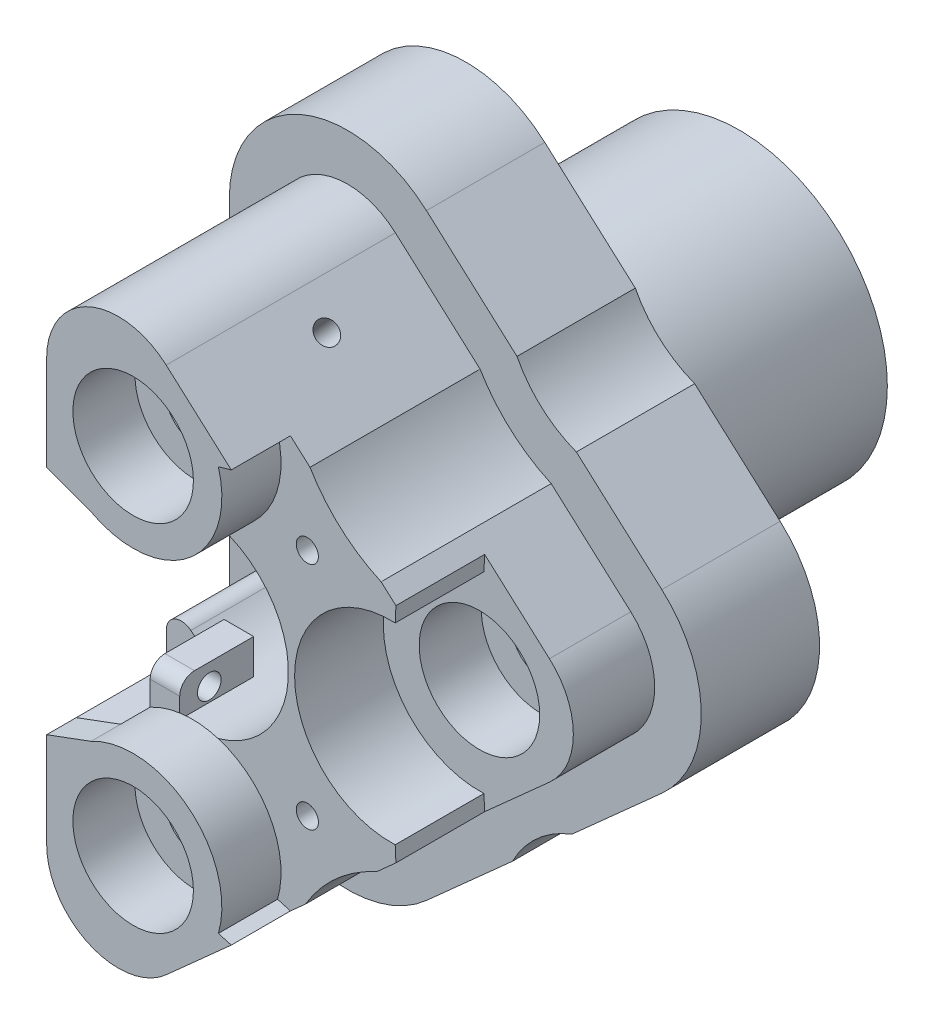
from build123d import *
from build123d.topology import SkipClean

# Parameters (mm, degrees)
BOSS_EXTRUDE1_DEPTH  = 15.5
BOSS_EXTRUDE3_START  = -2
SKETCH1_3_R          = 6.5
BOSS_EXTRUDE3_DEPTH  = 2
CUT_EXTRUDE11_START  = -4
CUT_EXTRUDE11_DEPTH  = 4
CUT_EXTRUDE13_START  = -10
CUT_EXTRUDE13_DEPTH  = 10
SKETCH15_R           = 2.500000000000001
CUT_EXTRUDE14_DEPTH  = 4.2
SKETCH16_R           = 2.5000000000000004
CUT_EXTRUDE15_DEPTH  = 4.2
SKETCH17_R           = 1.7499999999999998
CUT_EXTRUDE16_DEPTH  = 3
SKETCH18_R           = 1.4999999999999987
CUT_EXTRUDE17_DEPTH  = 3
SKETCH19_R           = 0.7500000000000004
CUT_EXTRUDE18_DEPTH  = 5
SKETCH20_R           = 0.7500000000000004
CUT_EXTRUDE19_DEPTH  = 5
SKETCH21_R           = 0.7500000000000004
CUT_EXTRUDE20_DEPTH  = 5
SKETCH22_R           = 0.7500000000000004
CUT_EXTRUDE21_DEPTH  = 5
BOSS_EXTRUDE4_START  = 15
SKETCH25_R           = 6.500000000000002
BOSS_EXTRUDE4_DEPTH  = 15
BOSS_EXTRUDE5_START  = -5
BOSS_EXTRUDE5_DEPTH  = 5
SKETCH29_R           = 4.074999999999996
SKETCH29_R_2         = 2.5000000000000013
SKETCH29_R_3         = 4.075
CUT_EXTRUDE27_DEPTH  = 4.2
SKETCH30_R           = 4.074999999999999
SKETCH30_R_2         = 2.5000000000000004
CUT_EXTRUDE28_DEPTH  = 4.2
SKETCH31_R           = 2
SKETCH31_R_2         = 1.7499999999999996
CUT_EXTRUDE30_DEPTH  = 3
SKETCH32_R           = 1.9999999999999996
CUT_EXTRUDE31_DEPTH  = 3
SKETCH33_R           = 0.7499999999999984
CUT_EXTRUDE32_DEPTH  = 8
SKETCH34_R           = 6.500000000000003
CUT_EXTRUDE33_DEPTH  = 6
CUT_EXTRUDE34_DEPTH  = 35.00000000000001
BOSS_EXTRUDE6_START  = 1
BOSS_EXTRUDE6_DEPTH  = 1
BOSS_EXTRUDE7_START  = 8.5
SKETCH39_R           = 6.500000000000002
BOSS_EXTRUDE7_DEPTH  = 8.5
SKETCH40_R           = 1.3
SKETCH40_R_2         = 1.2999999999999983
CUT_EXTRUDE36_DEPTH  = 8.5
BOSS_EXTRUDE8_START  = 5
BOSS_EXTRUDE8_DEPTH  = 5
BOSS_EXTRUDE9_DEPTH  = 3
CUT_EXTRUDE38_DEPTH  = 3
CUT_EXTRUDE39_START  = -8
CUT_EXTRUDE39_DEPTH  = 8
SKETCH45_W           = 8.100000000000005
SKETCH45_H           = 1.758590385799863
SKETCH45_H_2         = 1.7585903857998666
SKETCH45_H_3         = 1.9914096142001334
BOSS_EXTRUDE10_DEPTH = 2
SKETCH46_R           = 0.8000000000000009
CUT_EXTRUDE40_DEPTH  = 4
BOSS_EXTRUDE12_START = -4
BOSS_EXTRUDE12_DEPTH = 4
CUT_EXTRUDE42_START  = -4
CUT_EXTRUDE42_DEPTH  = 4
BOSS_EXTRUDE14_START = 0.9
BOSS_EXTRUDE14_DEPTH = 0.9
FILLET5_R            = 1
FILLET4_R            = 1
BOSS_EXTRUDE13_DEPTH = 2


with BuildPart() as part:
    # Sketch1 → Boss-Extrude1 (new body)
    with BuildSketch(Plane.XY):
        with BuildLine():
            ThreePointArc((2.333333333333339, 17.962847939999442), (-3.0412414523193125, 18.80042262337618), (-6, 14.236067977499792))
            Line((-6, 14.236067977499793), (-5.999999999999999, 2.5000000000002522))
            ThreePointArc((-5.999999999999902, 2.500000000000234), (1.2747548783983207, 6.373774391990956), (6.5, 0))
            ThreePointArc((6.5, -1.59e-15), (1.2747548783983234, -6.373774391990955), (-5.9999999999999005, -2.500000000000238))
            Line((-5.999999999999998, -2.500000000000256), (-5.999999999999997, -14.236067977499793))
            ThreePointArc((-5.9999999999999964, -14.236067977499792), (-3.041241452319313, -18.800422623376175), (2.333333333333333, -17.96284793999944))
            Line((2.333333333333334, -17.96284793999944), (7.773705012480982, -13.096831581023915))
            ThreePointArc((7.773705012480981, -13.096831581023913), (9.826675189693717, -10.589778838962985), (12.546312033573123, -8.828082089401992))
            Line((12.546312033573123, -8.828082089401994), (18.249741198332075, -3.726779962499654))
            ThreePointArc((18.249741198332075, -3.726779962499654), (19.91640786499874, -4.11e-15), (18.249741198332075, 3.726779962499646))
            Line((18.249741198332075, 3.7267799624996445), (12.848616270294984, 8.557692960123482))
            ThreePointArc((12.848616270294983, 8.55769296012348), (10.128979426415608, 10.319389709684462), (8.076009249202896, 12.826442451745363))
            Line((8.076009249202896, 12.826442451745363), (2.3333333333333384, 17.962847939999442))
        make_face()
    extrude(amount=BOSS_EXTRUDE1_DEPTH)

    # Sketch1<3> → Boss-Extrude3 (add)
    with BuildSketch(Plane.XY.offset(BOSS_EXTRUDE3_START)):
        with BuildLine():
            Line((-9.000000000000002, 14.236067977499793), (-8.999999999999998, -14.236067977499792))
            ThreePointArc((-8.999999999999998, -14.236067977499792), (-4.265986323710903, -21.539035410902006), (4.333333333333334, -20.19891591749923))
            Line((4.333333333333334, -20.19891591749923), (10.153076093228329, -14.993579748424253))
            ThreePointArc((10.153076093228329, -14.993579748424253), (11.826675189693717, -12.825846816462779), (14.166940952825776, -11.403469877001235))
            Line((14.166940952825776, -11.403469877001235), (20.249741198332075, -5.962847939999441))
            ThreePointArc((20.249741198332075, -5.962847939999441), (22.91640786499874, -5.2e-15), (20.249741198332075, 5.962847939999432))
            Line((20.249741198332075, 5.962847939999432), (14.469245189547644, 11.133080747722715))
            ThreePointArc((14.469245189547644, 11.133080747722715), (12.128979426415611, 12.555457687184248), (10.455380329950238, 14.723190619145699))
            Line((10.455380329950238, 14.723190619145699), (4.333333333333336, 20.19891591749924))
            ThreePointArc((4.333333333333336, 20.19891591749924), (-4.265986323710905, 21.539035410902013), (-9.000000000000002, 14.236067977499793))
        make_face()
        with Locations(Location((0, 0, 0), (0, 0, 202.619864948))):
            Circle(SKETCH1_3_R, mode=Mode.SUBTRACT)
    extrude(amount=BOSS_EXTRUDE3_DEPTH)

    # Sketch14 → Cut-Extrude11 (cut)
    with BuildSketch(Plane.XY.offset(15.5).offset(CUT_EXTRUDE11_START)):
        with BuildLine():
            Line((6.805469288332918, 13.962847939999444), (5.7650020462537634, 13.662754163034908))
            ThreePointArc((5.765002046253755, 13.66275416303494), (5.273685061680846, 9.13848888343863), (1.7484802428744484, 6.260416666666672))
            ThreePointArc((1.748480242874447, 6.260416666666668), (6.500000000000002, -1.0991e-13), (1.748480242874225, -6.260416666666719))
            ThreePointArc((1.748480242874229, -6.260416666666605), (5.273685061680793, -9.138488883438532), (5.765002046253753, -13.662754163034947))
            Line((5.7650020462537634, -13.662754163034915), (6.8054692883329135, -13.962847939999449))
            Line((6.805469288332911, -13.962847939999445), (7.77370501248098, -13.096831581023919))
            ThreePointArc((7.7737050124809794, -13.096831581023919), (9.826675189693713, -10.589778838962985), (12.546312033573123, -8.828082089401992))
            Line((12.546312033573123, -8.828082089401992), (18.249741198332075, -3.726779962499654))
            ThreePointArc((18.249741198332075, -3.7267799624996543), (19.91640786499874, -5.22e-15), (18.249741198332075, 3.726779962499643))
            Line((18.249741198332075, 3.726779962499643), (12.848616270294986, 8.557692960123482))
            ThreePointArc((12.848616270294986, 8.557692960123482), (10.128979426415611, 10.31938970968446), (8.076009249202896, 12.826442451745361))
            Line((8.076009249202896, 12.826442451745361), (6.805469288332915, 13.962847939999442))
        make_face()
    extrude(amount=CUT_EXTRUDE11_DEPTH, mode=Mode.SUBTRACT)

    # Sketch14<4> → Cut-Extrude13 (cut)
    with BuildSketch(Plane.XY.offset(15.5).offset(CUT_EXTRUDE13_START)):
        with BuildLine():
            Line((18.249741198332075, 3.7267799624996436), (13.777605243332493, 7.726779962499647))
            Line((13.777605243332493, 7.726779962499646), (13.684905148289488, 5.743727814657093))
            ThreePointArc((13.68490514828951, 5.743727814657091), (7.666407864998731, 5.81e-15), (13.6849051482895, -5.743727814657092))
            Line((13.684905148289488, -5.743727814657093), (13.777605243332491, -7.726779962499654))
            Line((13.777605243332491, -7.726779962499652), (18.249741198332075, -3.726779962499654))
            ThreePointArc((18.249741198332075, -3.7267799624996543), (19.91640786499874, -5.22e-15), (18.249741198332075, 3.726779962499643))
        make_face()
    extrude(amount=CUT_EXTRUDE13_DEPTH, mode=Mode.SUBTRACT)

    # Sketch15 → Cut-Extrude14 (cut)
    with BuildSketch(Plane.XY.offset(15.5)):
        with Locations((0, 12)):
            Circle(SKETCH15_R)
        with Locations((0, -12)):
            Circle(SKETCH15_R)
    extrude(amount=-CUT_EXTRUDE14_DEPTH, mode=Mode.SUBTRACT)

    # Sketch16 → Cut-Extrude15 (cut)
    with BuildSketch(Plane.XY.offset(5.5)):
        with Locations((13.416407864998735, 0)):
            Circle(SKETCH16_R)
    extrude(amount=-CUT_EXTRUDE15_DEPTH, mode=Mode.SUBTRACT)

    # Sketch17 → Cut-Extrude16 (cut)
    with BuildSketch(Plane.XY.offset(11.299999999999999)):
        with Locations((0, -12)):
            Circle(SKETCH17_R)
        with Locations((0, 12)):
            Circle(SKETCH17_R)
    extrude(amount=-CUT_EXTRUDE16_DEPTH, mode=Mode.SUBTRACT)

    # Sketch18 → Cut-Extrude17 (cut)
    with BuildSketch(Plane.XY.offset(1.2999999999999992)):
        with Locations((13.416407864998735, 0)):
            Circle(SKETCH18_R)
    extrude(amount=-CUT_EXTRUDE17_DEPTH, mode=Mode.SUBTRACT)

    # Sketch19 → Cut-Extrude18 (cut)
    with BuildSketch(Plane(origin=(9.962847939999445, -11.138802621666256, 0), x_dir=(0.74535599249993, 0.6666666666666667, 0), z_dir=(0.6666666666666667, -0.74535599249993, 0))):
        with Locations((-7.736067977499796, 6.500000000000001)):
            Circle(SKETCH19_R)
    extrude(amount=-CUT_EXTRUDE18_DEPTH, mode=Mode.SUBTRACT)

    # Sketch20 → Cut-Extrude19 (cut)
    with BuildSketch(Plane.ZY.offset(5.999999999999998)):
        with Locations(Location((6.500000000000001, -11.73606797749979, 0), (0, 0, 270))):
            Circle(SKETCH20_R)
    extrude(amount=-CUT_EXTRUDE19_DEPTH, mode=Mode.SUBTRACT)

    # Sketch21 → Cut-Extrude20 (cut)
    with BuildSketch(Plane.ZY.offset(5.999999999999998)):
        with Locations(Location((6.500000000000001, 11.736067977499792, 0), (0, 0, 270))):
            Circle(SKETCH21_R)
    extrude(amount=-CUT_EXTRUDE20_DEPTH, mode=Mode.SUBTRACT)

    # Sketch22 → Cut-Extrude21 (cut)
    with BuildSketch(Plane(origin=(9.962847939999449, 11.138802621666251, 0), x_dir=(0.7453559924999298, -0.6666666666666669, 0), z_dir=(0.6666666666666669, 0.7453559924999298, 0))):
        with Locations(Location((-7.736067977499794, -6.500000000000001, 0), (0, 0, 180))):
            Circle(SKETCH22_R)
    extrude(amount=-CUT_EXTRUDE21_DEPTH, mode=Mode.SUBTRACT)

    # Sketch25 → Boss-Extrude4 (add)
    with SkipClean():  # the faces are left unmerged after this step: merging them gives an invalid solid
        with BuildSketch(Plane(origin=(0, 0, -2), x_dir=(-1, 0, 0), z_dir=(0, 0, -1)).offset(BOSS_EXTRUDE4_START)):
            with BuildLine():
                Line((9, -4.358898943540911), (9, 4.358898943540908))
                ThreePointArc((8.999999999999897, 4.358898943540885), (-10, 1.22e-15), (8.999999999999897, -4.358898943540887))
            make_face()
            Circle(SKETCH25_R, mode=Mode.SUBTRACT)
        extrude(amount=-BOSS_EXTRUDE4_DEPTH)

    # Sketch27 → Boss-Extrude5 (add)
    with SkipClean():  # the faces are left unmerged after this step: merging them gives an invalid solid
        with BuildSketch(Plane.XY.offset(11.5).offset(BOSS_EXTRUDE5_START)):
            with BuildLine():
                ThreePointArc((1.1287131548350784, 6.401250394579349), (-1.1287131548350324, 6.401250394579357), (-3.2500000000000018, 5.6291651245988525))
                Line((-3.2499999999999685, 5.62916512459887), (-2.7499999999999725, 4.7631397208144275))
                ThreePointArc((-2.7500000000001203, 4.763139720814343), (-0.9550649771682416, 5.416442641567122), (0.9550649771680044, 5.416442641567164))
                Line((0.9550649771680784, 5.41644264156715), (1.1287131548350022, 6.401250394579362))
            make_face()
            with BuildLine():
                Line((1.1287131548350537, -6.401250394579352), (0.955064977168122, -5.416442641567142))
                ThreePointArc((0.9550649771680463, -5.416442641567157), (-0.9550649771682398, -5.416442641567123), (-2.750000000000154, -4.7631397208143245))
                Line((-2.750000000000005, -4.76313972081441), (-3.2500000000000067, -5.62916512459885))
                ThreePointArc((-3.2500000000000377, -5.629165124598831), (-1.1287131548350267, -6.401250394579357), (1.1287131548351317, -6.40125039457934))
            make_face()
        extrude(amount=BOSS_EXTRUDE5_DEPTH)

    # Sketch29 → Cut-Extrude27 (cut)
    # profile 1 of 2: a face of its own
    with SkipClean():  # the faces are left unmerged after this step: merging them gives an invalid solid
        with BuildSketch(Plane.XY.offset(15.5)):
            with Locations((0, 12)):
                Circle(SKETCH29_R)
            with Locations((0, 12)):
                Circle(SKETCH29_R_2, mode=Mode.SUBTRACT)
        # profile 2 of 2: a face of its own
        with BuildSketch(Plane.XY.offset(15.5)):
            with Locations((0, -12)):
                Circle(SKETCH29_R_3)
            with Locations((0, -12)):
                Circle(SKETCH29_R_2, mode=Mode.SUBTRACT)
        extrude(amount=-CUT_EXTRUDE27_DEPTH, mode=Mode.SUBTRACT)

    # Sketch30 → Cut-Extrude28 (cut)
    with SkipClean():  # the faces are left unmerged after this step: merging them gives an invalid solid
        with BuildSketch(Plane.XY.offset(5.5)):
            with Locations((13.416407864998735, 0)):
                Circle(SKETCH30_R)
            with Locations((13.416407864998735, 0)):
                Circle(SKETCH30_R_2, mode=Mode.SUBTRACT)
        extrude(amount=-CUT_EXTRUDE28_DEPTH, mode=Mode.SUBTRACT)

    # Sketch31 → Cut-Extrude30 (cut)
    # profile 1 of 2: a face of its own
    with SkipClean():  # the faces are left unmerged after this step: merging them gives an invalid solid
        with BuildSketch(Plane.XY.offset(11.299999999999999)):
            with Locations((0, 12)):
                Circle(SKETCH31_R)
            with Locations((0, 12)):
                Circle(SKETCH31_R_2, mode=Mode.SUBTRACT)
        # profile 2 of 2: a face of its own
        with BuildSketch(Plane.XY.offset(11.299999999999999)):
            with Locations((0, -12)):
                Circle(SKETCH31_R)
            with Locations((0, -12)):
                Circle(SKETCH31_R_2, mode=Mode.SUBTRACT)
        extrude(amount=-CUT_EXTRUDE30_DEPTH, mode=Mode.SUBTRACT)

    # Sketch32 → Cut-Extrude31 (cut)
    with SkipClean():  # the faces are left unmerged after this step: merging them gives an invalid solid
        with BuildSketch(Plane.XY.offset(1.2999999999999992)):
            with Locations((13.416407864998735, 0)):
                Circle(SKETCH32_R)
        extrude(amount=-CUT_EXTRUDE31_DEPTH, mode=Mode.SUBTRACT)

    # Sketch33 → Cut-Extrude32 (cut)
    with SkipClean():  # the faces are left unmerged after this step: merging them gives an invalid solid
        with BuildSketch(Plane.XY.offset(11.5)):
            with Locations((7.778174593052007, 7.778174593052036)):
                Circle(SKETCH33_R)
            with Locations((7.778174593052009, -7.778174593052034)):
                Circle(SKETCH33_R)
        extrude(amount=-CUT_EXTRUDE32_DEPTH, mode=Mode.SUBTRACT)

    # Sketch34 → Cut-Extrude33 (cut)
    with SkipClean():  # the faces are left unmerged after this step: merging them gives an invalid solid
        with BuildSketch(Plane.XY.offset(11.5)):
            with Locations((13.416407864998735, 0)):
                Circle(SKETCH34_R)
        extrude(amount=-CUT_EXTRUDE33_DEPTH, mode=Mode.SUBTRACT)

    # Sketch35 → Cut-Extrude34 (cut)
    with SkipClean():  # the faces are left unmerged after this step: merging them gives an invalid solid
        with BuildSketch(Plane.XY):
            with BuildLine():
                Line((-5.999999999999998, 2.5000000000000058), (-6, 14.236067977499793))
                ThreePointArc((-6, 14.236067977499793), (-3.0412414523193125, 18.80042262337618), (2.3333333333333375, 17.962847939999442))
                Line((2.3333333333333375, 17.962847939999442), (8.076009249202896, 12.826442451745361))
                ThreePointArc((8.076009249202896, 12.826442451745361), (10.128979426415611, 10.31938970968446), (12.848616270294984, 8.557692960123482))
                Line((12.848616270294984, 8.557692960123482), (18.249741198332075, 3.7267799624996436))
                ThreePointArc((18.249741198332075, 3.7267799624996436), (19.91640786499874, -4.09e-15), (18.249741198332075, -3.7267799624996507))
                Line((18.249741198332075, -3.7267799624996507), (12.546312033573123, -8.828082089401992))
                ThreePointArc((12.546312033573123, -8.828082089401992), (9.826675189693713, -10.589778838962985), (7.773705012480982, -13.09683158102392))
                Line((7.773705012480982, -13.09683158102392), (2.333333333333332, -17.962847939999445))
                ThreePointArc((2.333333333333332, -17.962847939999445), (-3.0412414523193156, -18.80042262337618), (-5.999999999999997, -14.236067977499792))
                Line((-5.999999999999997, -14.236067977499792), (-5.999999999999998, -2.5000000000000067))
                ThreePointArc((-5.999999999999998, -2.5000000000000067), (-6.500000000000001, -8e-16), (-5.999999999999998, 2.5000000000000058))
            make_face()
            with BuildLine():
                Line((7.958611909439632, 12.730199706605697), (2.233333333333337, 17.851044541124455))
                ThreePointArc((2.233333333333337, 17.851044541124455), (-2.980004208749736, 18.66349198399989), (-5.850000000000001, 14.236067977499793))
                Line((-5.850000000000001, 14.236067977499793), (-5.8500000000000005, 2.469817807045695))
                ThreePointArc((-5.8500000000000005, 2.469817807045695), (-6.350000000000001, -2.04e-15), (-5.849999999999999, -2.469817807045699))
                Line((-5.849999999999999, -2.469817807045699), (-5.849999999999998, -14.236067977499792))
                ThreePointArc((-5.849999999999998, -14.236067977499792), (-2.9800042087497385, -18.663491983999883), (2.2333333333333294, -17.85104454112446))
                Line((2.2333333333333294, -17.85104454112446), (7.656307672717711, -13.000588835884262))
                ThreePointArc((7.656307672717711, -13.000588835884262), (9.726675189693715, -10.477975440087999), (12.463709373336389, -8.700718036791674))
                Line((12.463709373336389, -8.700718036791674), (18.149741198332073, -3.6149765636246602))
                ThreePointArc((18.149741198332073, -3.6149765636246602), (19.766407864998737, -4.13e-15), (18.149741198332073, 3.6149765636246527))
                Line((18.149741198332073, 3.6149765636246527), (12.766013610058263, 8.430328907513159))
                ThreePointArc((12.766013610058263, 8.430328907513159), (10.028979426415619, 10.207586310809466), (7.958611909439632, 12.730199706605697))
            make_face(mode=Mode.SUBTRACT)
        extrude(amount=CUT_EXTRUDE34_DEPTH, mode=Mode.SUBTRACT)

    # Sketch37 → Boss-Extrude6 (add)
    with SkipClean():  # the faces are left unmerged after this step: merging them gives an invalid solid
        with BuildSketch(Plane(origin=(0, 0, -2), x_dir=(-1, 0, 0), z_dir=(0, 0, -1)).offset(BOSS_EXTRUDE6_START)):
            with BuildLine():
                Line((9, 4.358898943540674), (9.000000000000002, 14.236067977499793))
                ThreePointArc((9.000000000000002, 14.236067977499793), (4.265986323710905, 21.53903541090201), (-4.333333333333336, 20.198915917499235))
                Line((-4.333333333333336, 20.198915917499235), (-10.455380329950238, 14.723190619145699))
                ThreePointArc((-10.455380329950238, 14.723190619145699), (-12.128979426415611, 12.555457687184248), (-14.469245189547644, 11.133080747722715))
                Line((-14.469245189547644, 11.133080747722715), (-20.249741198332075, 5.962847939999429))
                ThreePointArc((-20.249741198332075, 5.962847939999429), (-22.91640786499874, -6.7e-16), (-20.249741198332075, -5.962847939999437))
                Line((-20.249741198332075, -5.962847939999437), (-14.166940952825776, -11.403469877001235))
                ThreePointArc((-14.166940952825776, -11.403469877001235), (-11.826675189693717, -12.82584681646278), (-10.153076093228329, -14.993579748424258))
                Line((-10.153076093228329, -14.993579748424258), (-4.333333333333335, -20.19891591749923))
                ThreePointArc((-4.333333333333335, -20.19891591749923), (4.265986323710904, -21.539035410902006), (8.999999999999998, -14.236067977499792))
                Line((8.999999999999998, -14.236067977499792), (8.999999999999998, -4.358898943540678))
                ThreePointArc((8.999999999999998, -4.358898943540678), (-10, 5.67e-15), (9, 4.358898943540674))
            make_face()
        extrude(amount=-BOSS_EXTRUDE6_DEPTH)

    # Sketch39 → Boss-Extrude7 (add)
    with SkipClean():  # the faces are left unmerged after this step: merging them gives an invalid solid
        with BuildSketch(Plane(origin=(0, 0, -17), x_dir=(-1, 0, 0), z_dir=(0, 0, -1)).offset(BOSS_EXTRUDE7_START)):
            with BuildLine():
                Line((9, -4.358898943540676), (9, 4.358898943540674))
                ThreePointArc((9, 4.358898943540674), (-10, 5.67e-15), (9, -4.358898943540676))
            make_face()
            Circle(SKETCH39_R, mode=Mode.SUBTRACT)
        extrude(amount=-BOSS_EXTRUDE7_DEPTH)

    # Sketch40 → Cut-Extrude36 (cut)
    with SkipClean():  # the faces are left unmerged after this step: merging them gives an invalid solid
        with BuildSketch(Plane.ZY.offset(9)):
            with Locations(Location((-5.500000000000002, 0, 0), (0, 0, 270))):
                Circle(SKETCH40_R)
            with Locations(Location((-17.5, 0, 0), (0, 0, 270))):
                Circle(SKETCH40_R_2)
        extrude(amount=-CUT_EXTRUDE36_DEPTH, mode=Mode.SUBTRACT)

    # Sketch41 → Boss-Extrude8 (add)
    with SkipClean():  # the faces are left unmerged after this step: merging them gives an invalid solid
        with BuildSketch(Plane(origin=(0, 0, -3), x_dir=(-1, 0, 0), z_dir=(0, 0, -1)).offset(BOSS_EXTRUDE8_START)):
            with BuildLine():
                Line((9, 4.358898943540674), (9.000000000000002, 14.236067977499793))
                ThreePointArc((9.000000000000002, 14.236067977499793), (4.265986323710905, 21.53903541090201), (-4.333333333333336, 20.198915917499235))
                Line((-4.333333333333336, 20.198915917499235), (-10.455380329950238, 14.723190619145699))
                ThreePointArc((-10.455380329950238, 14.723190619145699), (-12.128979426415611, 12.555457687184248), (-14.469245189547644, 11.133080747722715))
                Line((-14.469245189547644, 11.133080747722715), (-20.249741198332075, 5.962847939999429))
                ThreePointArc((-20.249741198332075, 5.962847939999429), (-22.91640786499874, -6.7e-16), (-20.249741198332075, -5.962847939999437))
                Line((-20.249741198332075, -5.962847939999437), (-14.166940952825776, -11.403469877001239))
                ThreePointArc((-14.166940952825776, -11.403469877001239), (-11.826675189693717, -12.82584681646278), (-10.153076093228329, -14.993579748424258))
                Line((-10.153076093228329, -14.993579748424258), (-4.333333333333339, -20.198915917499225))
                ThreePointArc((-4.333333333333339, -20.198915917499225), (4.265986323710898, -21.539035410902006), (8.999999999999998, -14.236067977499792))
                Line((8.999999999999998, -14.236067977499792), (8.999999999999998, -4.358898943540678))
                ThreePointArc((8.999999999999998, -4.358898943540678), (-10, 5.67e-15), (9, 4.358898943540674))
            make_face()
        extrude(amount=-BOSS_EXTRUDE8_DEPTH)

    # Sketch43 → Boss-Extrude9 (add)
    with SkipClean():  # the faces are left unmerged after this step: merging them gives an invalid solid
        with BuildSketch(Plane(origin=(0, 0, 6.5), x_dir=(-1, 0, 0), z_dir=(0, 0, -1))):
            with BuildLine():
                Line((-0.9550649771680783, 5.416442641567152), (-0.6945927106676931, 3.9392310120488374))
                ThreePointArc((-0.6945927106678551, 3.9392310120488085), (0.6945927106676211, 3.93923101204885), (1.9999999999999405, 3.464101615137789))
                Line((1.9999999999999807, 3.464101615137766), (2.7499999999999734, 4.763139720814428))
                ThreePointArc((2.7499999999999734, 4.763139720814428), (0.9550649771681203, 5.416442641567143), (-0.955064977168079, 5.416442641567153))
            make_face()
            with BuildLine():
                ThreePointArc((1.9999999999999634, -3.4641016151377757), (0.6945927106676149, -3.939231012048851), (-0.6945927106678893, -3.9392310120488028))
                Line((-0.6945927106677282, -3.9392310120488303), (-0.9550649771681264, -5.4164426415671425))
                ThreePointArc((-0.9550649771681263, -5.416442641567142), (0.9550649771681146, -5.416442641567143), (2.7500000000000044, -4.76313972081441))
                Line((2.7500000000000044, -4.76313972081441), (2.000000000000003, -3.4641016151377526))
            make_face()
        extrude(amount=-BOSS_EXTRUDE9_DEPTH)

    # Sketch42 → Cut-Extrude38 (cut)
    with SkipClean():  # the faces are left unmerged after this step: merging them gives an invalid solid
        with BuildSketch(Plane.ZY.offset(5.8500000000000005)):
            Polygon((7.399999999999999, -2.8332843133014416), (7.3999999999999995, -7.833284313301447), (15.5, -7.833284313301445), (15.5, -2.8332843133014416), align=None)
            Polygon((7.399999999999998, 7.83328431330144), (7.399999999999999, 2.83328431330144), (15.5, 2.83328431330144), (15.5, 7.833284313301442), align=None)
        extrude(amount=-CUT_EXTRUDE38_DEPTH, mode=Mode.SUBTRACT)

    # Sketch44 → Cut-Extrude39 (cut)
    with SkipClean():  # the faces are left unmerged after this step: merging them gives an invalid solid
        with BuildSketch(Plane.XY.offset(11.5).offset(CUT_EXTRUDE39_START)):
            with BuildLine():
                ThreePointArc((0.9550649771681221, -5.4164426415671425), (-0.9550649771681178, -5.416442641567143), (-2.7500000000000044, -4.76313972081441))
                Line((-2.7500000000000044, -4.76313972081441), (-2.8499999999999996, -4.9363448015712885))
                Line((-2.8499999999999996, -4.9363448015712885), (-2.8499999999999996, -5.841874699101308))
                ThreePointArc((-2.8499999999999996, -5.841874699101308), (-0.9049488344693095, -6.4366969485126955), (1.1287131548350535, -6.4012503945793515))
                Line((1.1287131548350535, -6.4012503945793515), (0.9550649771681221, -5.4164426415671425))
            make_face()
            with BuildLine():
                ThreePointArc((-2.0000000000000036, -3.4641016151377526), (-0.6945927106677203, -3.9392310120488325), (0.6945927106677285, -3.939231012048832))
                Line((0.6945927106677285, -3.939231012048832), (0.9550649771681221, -5.4164426415671425))
                ThreePointArc((0.9550649771681221, -5.4164426415671425), (-0.9550649771681178, -5.416442641567143), (-2.7500000000000044, -4.76313972081441))
                Line((-2.7500000000000044, -4.76313972081441), (-2.0000000000000036, -3.4641016151377526))
            make_face()
            with BuildLine():
                ThreePointArc((0.6945927106676931, 3.9392310120488374), (-0.6945927106677248, 3.9392310120488316), (-1.9999999999999805, 3.4641016151377655))
                Line((-1.9999999999999805, 3.4641016151377655), (-2.7499999999999734, 4.763139720814428))
                ThreePointArc((-2.7499999999999734, 4.763139720814428), (-0.9550649771681203, 5.416442641567143), (0.9550649771680781, 5.416442641567152))
                Line((0.9550649771680781, 5.416442641567152), (0.6945927106676931, 3.9392310120488374))
            make_face()
            with BuildLine():
                ThreePointArc((0.9550649771680786, 5.416442641567151), (-0.9550649771681203, 5.416442641567143), (-2.7499999999999734, 4.763139720814428))
                Line((-2.7499999999999734, 4.763139720814428), (-2.8500000000000005, 4.936344801571365))
                Line((-2.8500000000000005, 4.936344801571365), (-2.8500000000000005, 5.841874699101308))
                ThreePointArc((-2.8500000000000005, 5.841874699101308), (-0.9049488344693355, 6.436696948512693), (1.1287131548350022, 6.401250394579361))
                Line((1.1287131548350022, 6.401250394579361), (0.9550649771680786, 5.416442641567151))
            make_face()
            with BuildLine():
                Line((-2.8499999999999996, -4.9363448015712885), (-2.7500000000000044, -4.76313972081441))
                Line((-2.7500000000000044, -4.76313972081441), (-2.0000000000000036, -3.4641016151377526))
                ThreePointArc((-2.000000000000004, -3.4641016151377526), (-0.69459271066772, -3.9392310120488334), (0.6945927106677289, -3.9392310120488325))
                Line((0.6945927106677285, -3.939231012048832), (0.9550649771681221, -5.4164426415671425))
                Line((0.9550649771681221, -5.4164426415671425), (1.1287131548350506, -6.401250394579352))
                ThreePointArc((1.1287131548350506, -6.401250394579354), (4.979288880273361, -4.1781194629625045), (6.500000000000002, -1.59e-15))
                ThreePointArc((6.500000000000002, 0), (4.979288880273344, 4.178119462962524), (1.1287131548350025, 6.401250394579362))
                Line((1.1287131548350022, 6.401250394579361), (0.9550649771680786, 5.416442641567151))
                Line((0.9550649771680781, 5.416442641567152), (0.6945927106676931, 3.9392310120488374))
                ThreePointArc((0.6945927106676931, 3.9392310120488374), (-0.6945927106677247, 3.9392310120488316), (-1.9999999999999805, 3.4641016151377655))
                Line((-1.9999999999999805, 3.4641016151377655), (-2.749999999999974, 4.7631397208144275))
                Line((-2.7499999999999734, 4.763139720814428), (-2.8500000000000005, 4.936344801571365))
                Line((-2.8500000000000005, 4.936344801571365), (-2.8500000000000005, 5.841874699101308))
                ThreePointArc((-2.8500000000000014, 5.841874699101309), (-6.500000000000002, 8e-16), (-2.8500000000000028, -5.841874699101309))
                Line((-2.8499999999999996, -5.841874699101308), (-2.8499999999999996, -4.9363448015712885))
            make_face()
        extrude(amount=CUT_EXTRUDE39_DEPTH, mode=Mode.SUBTRACT)

    # Sketch45 → Boss-Extrude10 (add)
    with SkipClean():  # the faces are left unmerged after this step: merging them gives an invalid solid
        with BuildSketch(Plane.ZY.offset(2.85)):
            Polygon((15.5, -7.833284313301445), (15.5, -5.841874699101308), (7.3999999999999995, -5.841874699101308), (7.399999999999999, -7.833284313301445), align=None)
            with Locations((11.45, -4.962579506201377)):
                Rectangle(SKETCH45_W, SKETCH45_H)
            with Locations((11.45, 4.962579506201375)):
                Rectangle(SKETCH45_W, SKETCH45_H_2)
            with Locations((11.45, 6.837579506201375)):
                Rectangle(SKETCH45_W, SKETCH45_H_3)
        extrude(amount=-BOSS_EXTRUDE10_DEPTH)

    # Sketch46 → Cut-Extrude40 (cut)
    with SkipClean():  # the faces are left unmerged after this step: merging them gives an invalid solid
        with BuildSketch(Plane.ZY.offset(2.85)):
            with Locations(Location((9.499999999999998, -5.503284313301444, 0), (0, 0, 270))):
                Circle(SKETCH46_R)
            with Locations(Location((9.499999999999998, 5.503284313301441, 0), (0, 0, 270))):
                Circle(SKETCH46_R)
        extrude(amount=-CUT_EXTRUDE40_DEPTH, mode=Mode.SUBTRACT)

    # Sketch47 → Boss-Extrude12 (add)
    with SkipClean():  # the faces are left unmerged after this step: merging them gives an invalid solid
        with BuildSketch(Plane.XY.offset(15.5).offset(BOSS_EXTRUDE12_START)):
            with BuildLine():
                ThreePointArc((1.7484802428744324, -6.260416666666668), (0.46022495227701343, -6.01767662247337), (-0.8500000000002212, -6.060513490208129))
                Line((-0.8500000000000018, -6.060513490208159), (-0.8500000000000022, -6.4441834238326905))
                ThreePointArc((-0.8500000000000023, -6.4441834238326905), (0.4585403384313669, -6.483806039513462), (1.748480242874432, -6.260416666666668))
            make_face()
            with BuildLine():
                Line((-0.8500000000000006, 6.44418342383269), (-0.8500000000000006, 6.060513490208159))
                ThreePointArc((-0.8500000000002215, 6.060513490208129), (0.460224952277012, 6.01767662247337), (1.7484802428744306, 6.260416666666668))
                ThreePointArc((1.7484802428744315, 6.260416666666666), (0.4585403384313673, 6.483806039513462), (-0.8500000000000005, 6.444183423832689))
            make_face()
        extrude(amount=BOSS_EXTRUDE12_DEPTH)

    # Sketch47<6> → Cut-Extrude42 (cut)
    with SkipClean():  # the faces are left unmerged after this step: merging them gives an invalid solid
        with BuildSketch(Plane.XY.offset(15.5).offset(CUT_EXTRUDE42_START)):
            with BuildLine():
                Line((-0.8499999999999996, -4.083284313301445), (-2.8499999999999996, -4.083284313301445))
                Line((-2.8499999999999996, -4.083284313301445), (-2.849999999999999, -6.720085227960645))
                ThreePointArc((-2.850000000000064, -6.720085227960622), (-1.87916436729494, -6.301865105081399), (-0.8500000000002226, -6.0605134902081295))
                Line((-0.8500000000000018, -6.060513490208159), (-0.8499999999999996, -4.083284313301445))
            make_face()
            with BuildLine():
                ThreePointArc((-0.8500000000002215, 6.060513490208129), (-1.879164367294945, 6.301865105081402), (-2.8500000000000703, 6.720085227960626))
                Line((-2.850000000000001, 6.720085227960645), (-2.8500000000000005, 4.083284313301442))
                Line((-2.8500000000000005, 4.083284313301442), (-0.8500000000000005, 4.083284313301442))
                Line((-0.8500000000000005, 4.083284313301442), (-0.8500000000000006, 6.060513490208159))
            make_face()
        extrude(amount=CUT_EXTRUDE42_DEPTH, mode=Mode.SUBTRACT)

    # Sketch49 → Boss-Extrude14 (add)
    with SkipClean():  # the faces are left unmerged after this step: merging them gives an invalid solid
        with BuildSketch(Plane(origin=(0, 8.2e-16, 7.399999999999999), x_dir=(-1, 0, 0), z_dir=(0, -1.1e-16, -1)).offset(BOSS_EXTRUDE14_START)):
            with BuildLine():
                Line((0.8499999999999996, -4.083284313301446), (0.8499999999999994, -6.444183423832691))
                ThreePointArc((0.8499999999999994, -6.444183423832691), (1.8743516078825464, -6.2238899452053404), (2.85, -5.841874699101309))
                Line((2.85, -5.841874699101309), (2.8499999999999996, -4.083284313301446))
                Line((2.8499999999999996, -4.083284313301446), (0.8499999999999996, -4.083284313301446))
            make_face()
            with BuildLine():
                Line((2.8500000000000005, 4.083284313301441), (2.8500000000000005, 5.841874699101307))
                ThreePointArc((2.8500000000000005, 5.841874699101307), (1.8743516078825473, 6.223889945205337), (0.8500000000000013, 6.444183423832689))
                Line((0.8500000000000013, 6.444183423832689), (0.8500000000000005, 4.083284313301441))
                Line((0.8500000000000005, 4.083284313301441), (2.8500000000000005, 4.083284313301441))
            make_face()
        extrude(amount=-BOSS_EXTRUDE14_DEPTH)

    # Fillet5
    fillet5_edges = [part.edges().sort_by_distance(p)[0] for p in [
        (-1.8499999999999996, -4.083284313301445, 11.5),
        (-1.8500000000000005, 4.083284313301442, 11.5),
    ]]
    fillet(fillet5_edges, radius=FILLET5_R)

    # Fillet4
    fillet4_edges = [part.edges().sort_by_distance(p)[0] for p in [
        (-5.8500000000000005, 2.833284313301436, 5.449999999999999),
        (-5.849999999999999, -2.833284313301442, 5.449999999999999),
    ]]
    fillet(fillet4_edges, radius=FILLET4_R)

    # Sketch48 → Boss-Extrude13 (add)
    with BuildSketch(Plane.XY.offset(15.5)):
        Polygon((-2.850000000000001, 6.720085227960588), (-2.850000000000001, 7.833284313301442), (-5.850000000000001, 7.833284313301442), align=None)
        Polygon((-2.849999999999999, -7.833284313301445), (-2.8499999999999996, -6.720085227960587), (-5.85, -7.833284313301445), align=None)
    extrude(amount=-BOSS_EXTRUDE13_DEPTH)


solid = part.part
